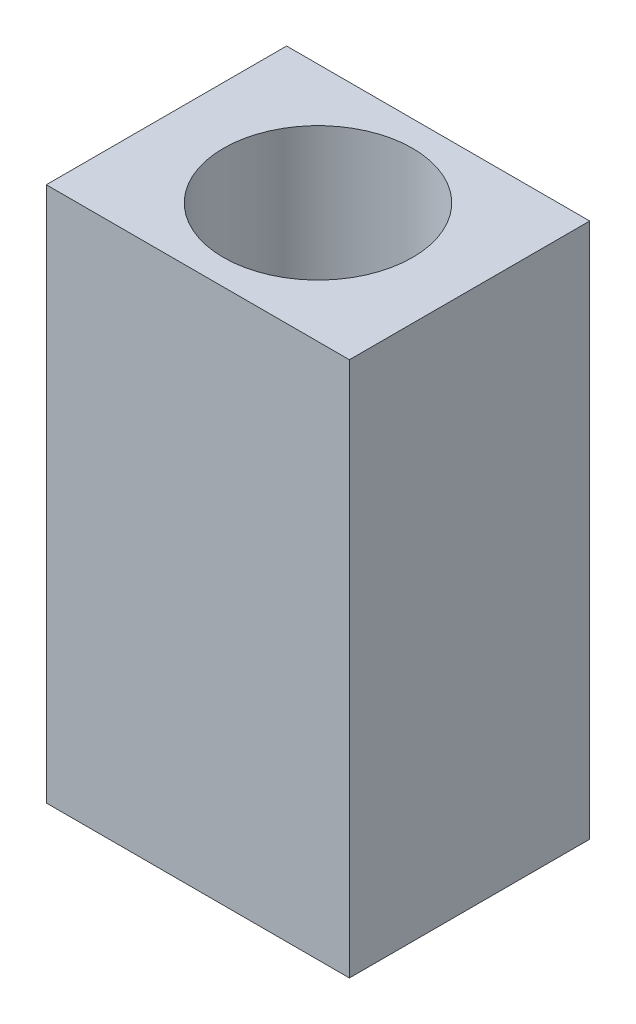
from build123d import *

# Parameters (mm, degrees)
SKETCH1_W                    = 8.491382686
SKETCH1_H                    = 6.732196236
SKETCH1_R                    = 2.5
BOSS_EXTRUDE1_DEPTH          = 15
TALADRO_DE_MARGEN_PARA_M51_D = 5.3


with BuildPart() as part:
    # Sketch1 → Boss-Extrude1 (new body)
    with BuildSketch(Plane(origin=(0, 0, 0), x_dir=(1, 0, 0), z_dir=(0, 1, 0))):
        Rectangle(SKETCH1_W, SKETCH1_H)
        Circle(SKETCH1_R, mode=Mode.SUBTRACT)
    extrude(amount=BOSS_EXTRUDE1_DEPTH)

    # Taladro de margen para M51 (through all)
    with Locations(Plane(origin=(0, 15, 0), x_dir=(1, 0, 0), z_dir=(0, 1, 0))):
        with Locations((0, 0)):
            Hole(TALADRO_DE_MARGEN_PARA_M51_D / 2)


solid = part.part
